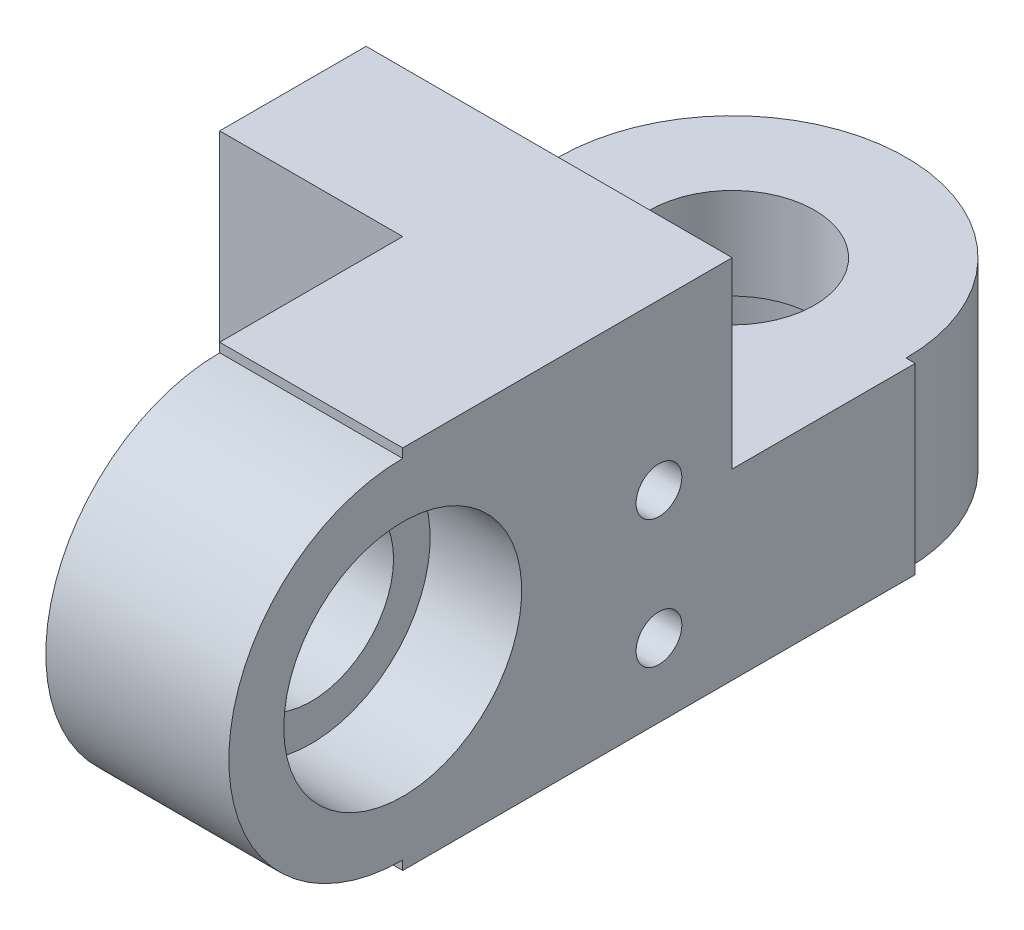
from build123d import *

# Parameters (mm, degrees)
SKETCH_1_W                = 20
SKETCH_1_H                = 20
EXTRUDE_1_DEPTH           = 50.534412113
SKETCH_7_W                = 21.267206056
SKETCH_7_H                = 10
CUT_EXTRUDE_6_DEPTH       = 34
SKETCH_3_R                = 4.5
CUT_EXTRUDE_2_DEPTH       = 21
SKETCH_2_R                = 6.5
CUT_EXTRUDE_9_DEPTH       = 5
MOVE_BODY_1_ANGLE         = 90
SKETCH_8_W                = 20
SKETCH_8_H                = 20
EXTRUDE_2_DEPTH           = 8
SKETCH_9_W                = 14
SKETCH_9_H                = 4
CUT_EXTRUDE_10_DEPTH      = 15
CUT_EXTRUDE_11_DEPTH      = 49
CUT_EXTRUDE_11_DEPTH_BACK = 49
SKETCH_10_R               = 1.25


# Read off the part's stored shape, not the designer's step: 교차3
with BuildPart() as part:
    # 스케치1 → 보스-돌출1 (new body)
    with BuildSketch(Plane.XY):
        Rectangle(SKETCH_1_W, SKETCH_1_H)
    extrude(amount=EXTRUDE_1_DEPTH)

    # 스케치7 → 컷-돌출6 (cut)
    with BuildSketch(Plane(origin=(10, 0, 0), x_dir=(0, 0, -1), z_dir=(1, 0, 0))):
        with Locations((-10.633603028, 5)):
            Rectangle(SKETCH_7_W, SKETCH_7_H)
    cut_extrude_6 = extrude(amount=-CUT_EXTRUDE_6_DEPTH, mode=Mode.SUBTRACT)

    # 스케치3 → 컷-돌출2 (cut)
    with BuildSketch(Plane(origin=(0, -10, 0), x_dir=(-1, 0, 0), z_dir=(0, -1, 0))):
        with Locations(Location((0, -11.267206056, 0), (0, 0, 90))):
            Circle(SKETCH_3_R)
        with BuildLine():
            Line((-21.262122506, -11.267206056), (-9.5, -11.267206056))
            ThreePointArc((-9.5, -11.267206056), (0, -1.767206056), (9.5, -11.267206056))
            Line((9.5, -11.267206056), (21.262122506, -11.267206056))
            ThreePointArc((21.262122506, -11.267206056), (0, 9.99491645), (-21.262122506, -11.267206056))
        make_face()
    cut_extrude_2 = extrude(amount=-CUT_EXTRUDE_2_DEPTH, mode=Mode.SUBTRACT)

    # 스케치2 → 컷-돌출9 (cut)
    with BuildSketch(Plane(origin=(0, -10, 0), x_dir=(-1, 0, 0), z_dir=(0, -1, 0))):
        with Locations(Location((0, -11.267206056, 0), (0, 0, 90))):
            Circle(SKETCH_2_R)
    cut_extrude_9 = extrude(amount=-CUT_EXTRUDE_9_DEPTH, mode=Mode.SUBTRACT)

    # 대칭 복사6: 컷-돌출6, 컷-돌출2, 컷-돌출9 across plane
    add(cut_extrude_6.mirror(Plane.XY.offset(25.267206056)), mode=Mode.SUBTRACT)
    add(cut_extrude_2.mirror(Plane.XY.offset(25.267206056)), mode=Mode.SUBTRACT)
    add(cut_extrude_9.mirror(Plane.XY.offset(25.267206056)), mode=Mode.SUBTRACT)


with BuildPart() as body_2:
    # 교차3: the piece on the far side of the plane
    add(part.part)
    split(bisect_by=Plane.XY.offset(25.267206056), keep=Keep.BOTTOM)


with BuildPart() as part_1:
    add(part.part)

    # 교차3
    split(bisect_by=Plane.XY.offset(25.267206056), keep=Keep.TOP)


with BuildPart() as part_2:
    # Move Body 1: moved
    add(part_1.part.rotate(Axis((0, 0, 0), (0, 0, 1)), MOVE_BODY_1_ANGLE))


    add(body_2.part)  # 보스-돌출2 merges body 2
    # 스케치8 → 보스-돌출2 (add)
    with BuildSketch(Plane.XY.offset(21.267206056)):
        Rectangle(SKETCH_8_W, SKETCH_8_H)
    extrude(amount=EXTRUDE_2_DEPTH)

    # 스케치9 → 컷-돌출10 (cut)
    with BuildSketch(Plane.XZ.offset(10)):
        with Locations((0, 25.267206056)):
            Rectangle(SKETCH_9_W, SKETCH_9_H)
    extrude(amount=-CUT_EXTRUDE_10_DEPTH, mode=Mode.SUBTRACT)

    # 스케치10 → 컷-돌출11 (cut, two sides: drawn at the far end of the back side and taken through both)
    with BuildSketch(Plane.ZY.offset(-7).offset(-CUT_EXTRUDE_11_DEPTH_BACK)):
        with Locations((25.267206056, -6)):
            Circle(SKETCH_10_R)
        with Locations((25.267206056, 1)):
            Circle(SKETCH_10_R)
    extrude(amount=CUT_EXTRUDE_11_DEPTH + CUT_EXTRUDE_11_DEPTH_BACK, mode=Mode.SUBTRACT)


solid = part_2.part
